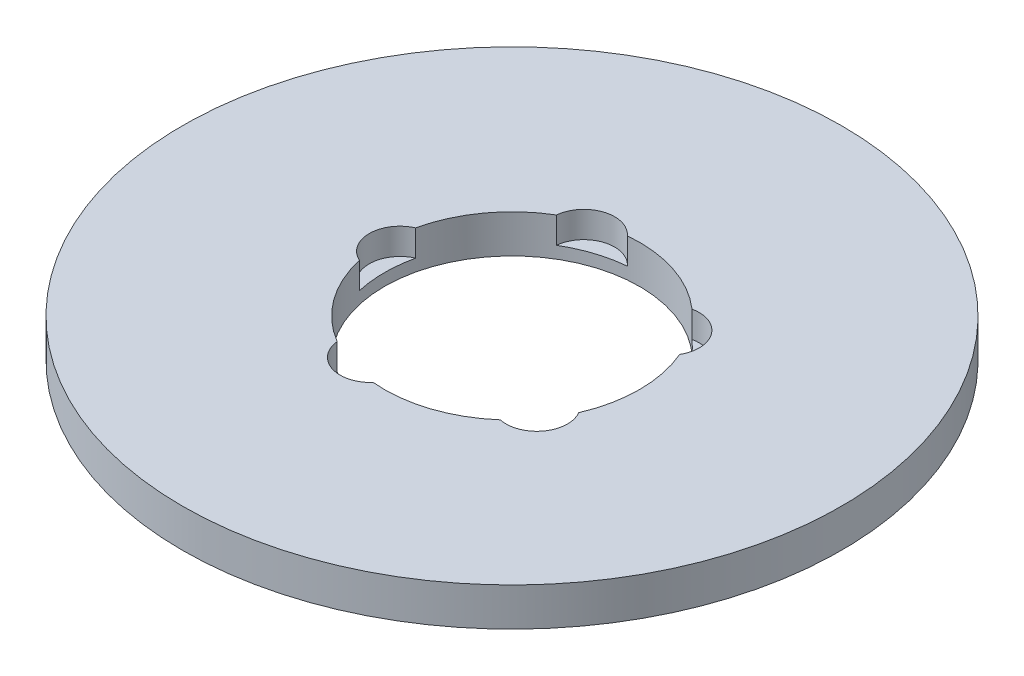
from build123d import *

# Parameters (mm, degrees)
SKETCH1_R           = 77.5
BOSS_EXTRUDE1_DEPTH = 9
SKETCH2_R           = 30
CUT_EXTRUDE1_DEPTH  = 110.970450577
SKETCH3_R           = 7.227110893
CUT_EXTRUDE2_DEPTH  = 6.174786187
CIRPATTERN1_COUNT   = 5


with BuildPart() as part:
    # Sketch1 → Boss-Extrude1 (new body)
    with BuildSketch(Plane(origin=(0, 0, 0), x_dir=(1, 0, 0), z_dir=(0, 1, 0))):
        Circle(SKETCH1_R)
    extrude(amount=BOSS_EXTRUDE1_DEPTH)

    # Sketch2 → Cut-Extrude1 (cut, through all)
    with BuildSketch(Plane(origin=(0, 0, 0), x_dir=(1, 0, 0), z_dir=(0, 1, 0))):
        Circle(SKETCH2_R)
    extrude(amount=CUT_EXTRUDE1_DEPTH, mode=Mode.SUBTRACT)

    # Sketch3 → Cut-Extrude2 (cut)
    with BuildSketch(Plane(origin=(0, 9, 0), x_dir=(1, 0, 0), z_dir=(0, 1, 0))):
        with Locations((-26.339988151, 0)):
            Circle(SKETCH3_R)
    cut_extrude2 = extrude(amount=-CUT_EXTRUDE2_DEPTH, mode=Mode.SUBTRACT)

    # CirPattern1: Cut-Extrude2 ×5 about axis
    cirpattern1_axis = Axis((0, 0, 0), (0, 1, 0))
    for i in range(1, CIRPATTERN1_COUNT):
        add(cut_extrude2.rotate(cirpattern1_axis, i * 360 / CIRPATTERN1_COUNT), mode=Mode.SUBTRACT)


solid = part.part
